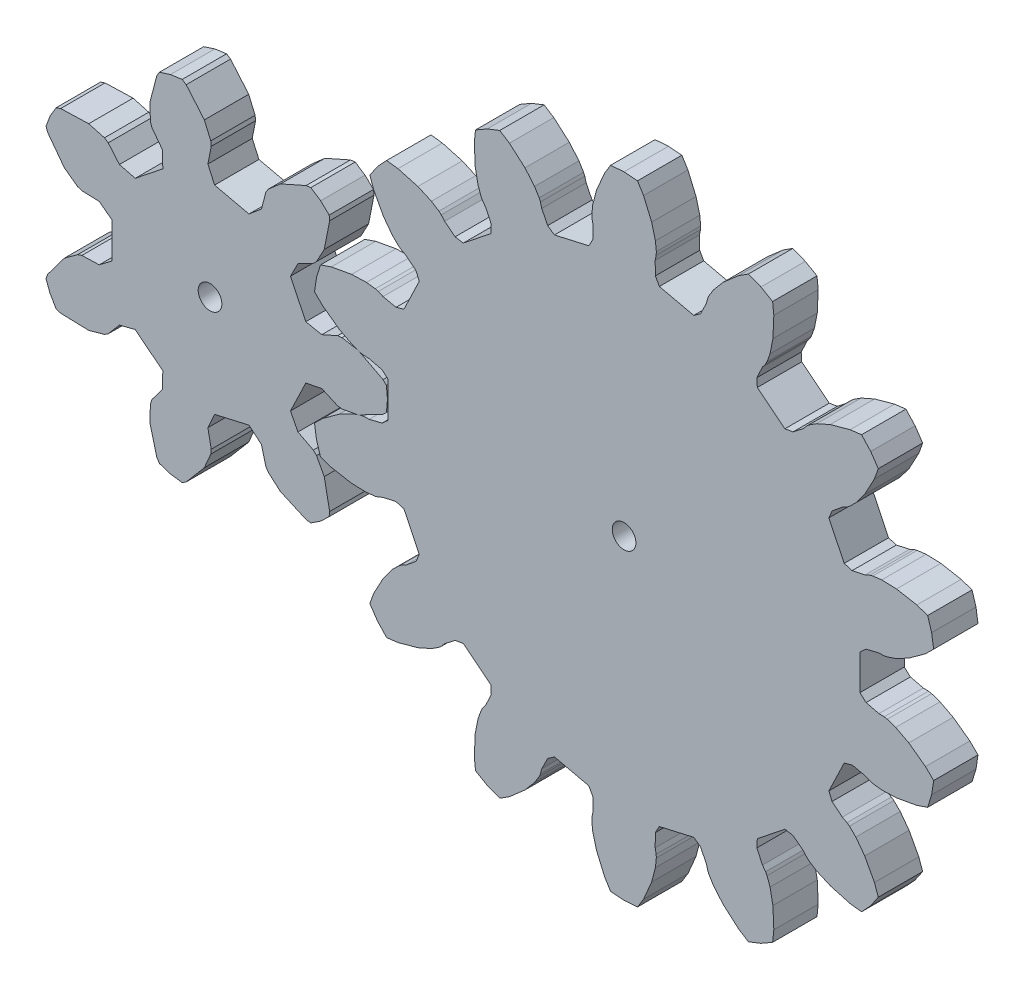
from build123d import *

# Parameters (mm, degrees)
MODEL_R             = 1.27
BOSS_EXTRUDE2_DEPTH = 4.7625
MODEL_4_R           = 1.27
BOSS_EXTRUDE3_DEPTH = 4.7625


with BuildPart() as part:
    # Model → Boss-Extrude2 (new body)
    with BuildSketch(Plane.XY):
        Polygon((10.317668308, -15.528627526), (10.823987774, -15.589294349), (11.877480725, -14.893889741), (12.789874323, -14.021552141), (12.843395225, -13.514427523), (12.262307132, -10.557590207), (11.434203924, -9.01713335), (11.089226134, -8.67698646), (9.440106563, -7.820222311), (8.639123878, -6.261194238), (10.281604408, -2.850548274), (11.999906173, -2.50474365), (13.697960592, -3.259893539), (14.178988273, -3.317529919), (15.863202798, -3.01114371), (15.932580395, -2.987415175), (18.573730848, -1.61526299), (18.936847104, -1.257231637), (19.05, 0), (18.936847104, 1.257231637), (18.573730848, 1.61526299), (15.932580395, 2.987415175), (15.863202798, 3.01114371), (14.178988273, 3.317529919), (13.697960592, 3.259893539), (11.999906173, 2.50474365), (10.281604408, 2.850548274), (8.639123878, 6.261194238), (9.440106563, 7.820222311), (11.089226134, 8.67698646), (11.434203924, 9.01713335), (12.262307132, 10.557590207), (12.843395225, 13.514427523), (12.789874323, 14.021552141), (11.877480725, 14.893889741), (10.823987774, 15.589294349), (10.317668308, 15.528627526), (7.564269343, 14.304150324), (6.246705254, 13.154025494), (5.991851337, 12.742007213), (5.523531681, 10.943586555), (4.181827113, 9.815769795), (0.491206862, 10.658129784), (-0.228285832, 12.256401368), (0.130078218, 14.079918676), (0.079230805, 14.56171129), (-0.608832959, 16.16960759), (-2.558278961, 18.467478467), (-2.988134689, 18.741821169), (-4.239023792, 18.572376727), (-5.439555119, 18.182300453), (-5.70780891, 17.748618808), (-6.46719026, 14.832475765), (-6.389474231, 13.085271578), (-6.226244186, 12.629129567), (-5.112174826, 11.141685575), (-5.066951293, 9.389516455), (-8.02659894, 7.029276216), (-9.724774339, 7.46326021), (-10.92702125, 8.880384951), (-11.335404727, 9.141023624), (-13.021509414, 9.605580658), (-16.033516909, 9.514141457), (-16.516017334, 9.349116593), (-17.163456933, 8.26548523), (-17.607002061, 7.083663464), (-17.435189601, 6.603538122), (-15.62872369, 4.191644428), (-14.214249299, 3.163041273), (-13.755850845, 3.006259769), (-11.89830942, 2.949868109), (-10.500212027, 1.892765714), (-10.500212027, -1.892765714), (-11.89830942, -2.949868109), (-13.755850845, -3.006259769), (-14.214249299, -3.163041273), (-15.62872369, -4.191644428), (-17.435189601, -6.603538122), (-17.607002061, -7.083663464), (-17.163456933, -8.26548523), (-16.516017334, -9.349116593), (-16.033516909, -9.514141457), (-13.021509414, -9.605580658), (-11.335404727, -9.141023624), (-10.92702125, -8.880384951), (-9.724774339, -7.46326021), (-8.02659894, -7.029276216), (-5.066951293, -9.389516455), (-5.112174826, -11.141685575), (-6.226244186, -12.629129567), (-6.389474231, -13.085271578), (-6.46719026, -14.832475765), (-5.70780891, -17.748618808), (-5.439555119, -18.182300453), (-4.239023792, -18.572376727), (-2.988134689, -18.741821169), (-2.558278961, -18.467478467), (-0.608832959, -16.16960759), (0.079230805, -14.56171129), (0.130078218, -14.079918676), (-0.228285832, -12.256401368), (0.491206862, -10.658129784), (4.181827113, -9.815769795), (5.523531681, -10.943586555), (5.991851337, -12.742007213), (6.246705254, -13.154025494), (7.564269343, -14.304150324), align=None)
        Circle(MODEL_R, mode=Mode.SUBTRACT)
    extrude(amount=BOSS_EXTRUDE2_DEPTH)


with BuildPart() as body_2:
    # Model<4> → Boss-Extrude3 (new body)
    with BuildSketch(Plane.XY):
        Polygon((15.932580395, -2.987415175), (15.863202798, -3.01114371), (15.295119363, -3.205439688), (13.885759197, -3.937642061), (12.092814379, -5.241468208), (11.216781635, -6.105233418), (11.432441374, -7.536042296), (11.858943369, -8.918727806), (13.022995277, -9.316857006), (15.204091704, -9.713634172), (16.791572041, -9.761827257), (17.744288084, -9.647673527), (18.063252407, -9.559792199), (18.573410138, -9.332917518), (19.968705688, -9.03480005), (20.819040198, -9.279259008), (22.461520729, -12.689904973), (22.122471543, -13.507140931), (21.019441375, -14.412153718), (20.523985464, -14.669557044), (20.256406073, -14.864140281), (19.573148356, -15.537829991), (18.621049426, -16.809019993), (17.571370927, -18.761656362), (17.156866376, -19.919978287), (17.971973793, -21.115521289), (18.956163572, -22.176225607), (20.177679888, -22.029864427), (22.314935027, -21.441006028), (23.766115584, -20.795644593), (24.574953632, -20.279427637), (24.824200278, -20.061855863), (25.185399276, -19.636099695), (26.313168806, -18.762109087), (27.185360495, -18.613412681), (30.145008142, -20.97365292), (30.194120775, -21.857065005), (29.592995265, -23.151040205), (29.258288032, -23.597922851), (29.101633833, -23.889334637), (28.778342911, -24.792762505), (28.472080088, -26.351165365), (28.373569608, -28.565868377), (28.50269096, -29.789327155), (29.755804035, -30.512812326), (31.102750741, -31.041449953), (32.139795177, -30.37958702), (33.809899436, -28.921723684), (34.837356108, -27.710629476), (35.342115865, -26.894592393), (35.472278478, -26.590422931), (35.612978853, -26.050111506), (36.249853776, -24.773352317), (36.971154382, -24.260951694), (40.661774633, -25.103311682), (41.089321724, -25.877929295), (41.109161152, -27.30457925), (41.001495468, -27.852430628), (40.986793747, -28.182953284), (41.087501353, -29.137184342), (41.487733744, -30.674139262), (42.359902492, -32.712259822), (43.00707568, -33.758534437), (44.449999999, -33.866666666), (45.892924318, -33.758534437), (46.540097506, -32.712259822), (47.412266254, -30.674139262), (47.812498645, -29.137184342), (47.913206251, -28.182953284), (47.89850453, -27.852430628), (47.790838846, -27.30457925), (47.810678274, -25.877929295), (48.238225365, -25.103311682), (51.928845616, -24.260951694), (52.650146222, -24.773352317), (53.287021145, -26.050111506), (53.42772152, -26.590422931), (53.557884133, -26.894592393), (54.06264389, -27.710629476), (55.090100562, -28.921723684), (56.760204821, -30.37958702), (57.797249257, -31.041449953), (59.144195964, -30.512812326), (60.397309038, -29.789327155), (60.526430391, -28.565868377), (60.427919911, -26.351165365), (60.121657087, -24.792762505), (59.798366166, -23.889334637), (59.641711967, -23.597922851), (59.307004733, -23.151040205), (58.705879223, -21.857065005), (58.754991856, -20.97365292), (61.714639503, -18.613412681), (62.586831192, -18.762109087), (63.714600722, -19.636099695), (64.07579972, -20.061855863), (64.325046366, -20.279427637), (65.133884414, -20.795644593), (66.585064971, -21.441006028), (68.72232011, -22.029864427), (69.943836426, -22.176225607), (70.928026205, -21.115521289), (71.743133622, -19.919978287), (71.328629071, -18.761656362), (70.278950572, -16.809019993), (69.326851643, -15.537829991), (68.643593925, -14.864140281), (68.376014534, -14.669557044), (67.880558623, -14.412153718), (66.777528455, -13.507140931), (66.43847927, -12.689904973), (68.0809598, -9.279259008), (68.93129431, -9.03480005), (70.32658986, -9.332917518), (70.836747591, -9.559792199), (71.155711914, -9.647673527), (72.108427957, -9.761827257), (73.695908294, -9.713634172), (75.877004721, -9.316857006), (77.041056629, -8.918727806), (77.467558624, -7.536042296), (77.683218363, -6.105233418), (76.80718562, -5.241468208), (75.014240801, -3.937642061), (73.604880636, -3.205439688), (72.696983693, -2.894920646), (72.371476489, -2.835705554), (71.813403021, -2.818763434), (70.426936847, -2.481961942), (69.766878693, -1.892765714), (69.766878693, 1.892765714), (70.426936847, 2.481961942), (71.813403021, 2.818763434), (72.371476489, 2.835705554), (72.696983693, 2.894920646), (73.604880636, 3.205439688), (75.014240801, 3.937642061), (76.80718562, 5.241468208), (77.683218363, 6.105233418), (77.467558624, 7.536042296), (77.041056629, 8.918727806), (75.877004721, 9.316857006), (73.695908294, 9.713634172), (72.108427957, 9.761827257), (71.155711914, 9.647673527), (70.836747591, 9.559792199), (70.32658986, 9.332917518), (68.93129431, 9.03480005), (68.0809598, 9.279259008), (66.43847927, 12.689904973), (66.777528455, 13.507140931), (67.880558623, 14.412153718), (68.376014534, 14.669557044), (68.643593925, 14.864140281), (69.326851643, 15.537829991), (70.278950572, 16.809019993), (71.328629071, 18.761656362), (71.743133622, 19.919978287), (70.928026205, 21.115521289), (69.943836426, 22.176225607), (68.72232011, 22.029864427), (66.585064971, 21.441006028), (65.133884414, 20.795644593), (64.325046366, 20.279427637), (64.07579972, 20.061855863), (63.714600722, 19.636099695), (62.586831192, 18.762109087), (61.714639503, 18.613412681), (58.754991856, 20.97365292), (58.705879223, 21.857065005), (59.307004733, 23.151040205), (59.641711967, 23.597922851), (59.798366166, 23.889334637), (60.121657087, 24.792762505), (60.427919911, 26.351165365), (60.526430391, 28.565868377), (60.397309038, 29.789327155), (59.144195964, 30.512812326), (57.797249257, 31.041449953), (56.760204821, 30.37958702), (55.090100562, 28.921723684), (54.06264389, 27.710629476), (53.557884133, 26.894592393), (53.42772152, 26.590422931), (53.287021145, 26.050111506), (52.650146222, 24.773352317), (51.928845616, 24.260951694), (48.238225365, 25.103311682), (47.810678274, 25.877929295), (47.790838846, 27.30457925), (47.89850453, 27.852430628), (47.913206251, 28.182953284), (47.812498645, 29.137184342), (47.412266254, 30.674139262), (46.540097506, 32.712259822), (45.892924318, 33.758534437), (44.449999999, 33.866666666), (43.00707568, 33.758534437), (42.359902492, 32.712259822), (41.487733744, 30.674139262), (41.087501353, 29.137184342), (40.986793747, 28.182953284), (41.001495468, 27.852430628), (41.109161152, 27.30457925), (41.089321724, 25.877929295), (40.661774633, 25.103311682), (36.971154382, 24.260951694), (36.249853776, 24.773352317), (35.612978853, 26.050111506), (35.472278478, 26.590422931), (35.342115865, 26.894592393), (34.837356108, 27.710629476), (33.809899436, 28.921723684), (32.139795177, 30.37958702), (31.102750741, 31.041449953), (29.755804035, 30.512812326), (28.50269096, 29.789327155), (28.373569608, 28.565868377), (28.472080088, 26.351165365), (28.778342911, 24.792762505), (29.101633833, 23.889334637), (29.258288032, 23.597922851), (29.592995265, 23.151040205), (30.194120775, 21.857065005), (30.145008142, 20.97365292), (27.185360495, 18.613412681), (26.313168806, 18.762109087), (25.185399276, 19.636099695), (24.824200278, 20.061855863), (24.574953632, 20.279427637), (23.766115584, 20.795644593), (22.314935027, 21.441006028), (20.177679888, 22.029864427), (18.956163572, 22.176225607), (17.971973793, 21.115521289), (17.156866376, 19.919978287), (17.571370927, 18.761656362), (18.621049426, 16.809019993), (19.573148356, 15.537829991), (20.256406073, 14.864140281), (20.523985464, 14.669557044), (21.019441375, 14.412153718), (22.122471543, 13.507140931), (22.461520729, 12.689904973), (20.819040198, 9.279259008), (19.968705688, 9.03480005), (18.573410138, 9.332917518), (18.063252407, 9.559792199), (17.744288084, 9.647673527), (16.791572041, 9.761827257), (15.204091704, 9.713634172), (13.022995277, 9.316857006), (11.858943369, 8.918727806), (11.432441374, 7.536042296), (11.216781635, 6.105233418), (12.092814379, 5.241468208), (13.885759197, 3.937642061), (15.295119363, 3.205439688), (15.863202798, 3.01114371), (15.932580395, 2.987415175), (16.203016305, 2.894920646), (16.528523509, 2.835705554), (17.086596977, 2.818763434), (18.473063151, 2.481961942), (19.133121305, 1.892765714), (19.133121305, -1.892765714), (18.473063151, -2.481961942), (17.086596977, -2.818763434), (16.528523509, -2.835705554), (16.203016305, -2.894920646), align=None)
        with Locations((44.449999999, 0)):
            Circle(MODEL_4_R, mode=Mode.SUBTRACT)
    extrude(amount=BOSS_EXTRUDE3_DEPTH)


solid = Compound([part.part, body_2.part])
